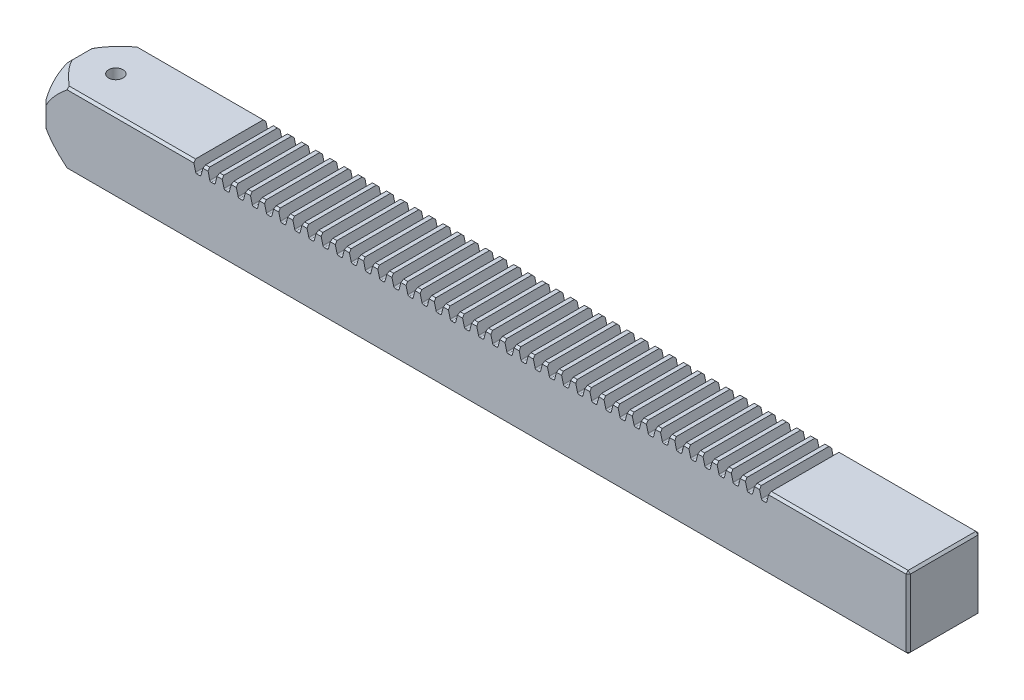
from build123d import *

# Parameters (mm, degrees)
SKETCH2_W                          = 25.4
SKETCH2_H                          = 25.4
BOSS_EXTRUDE1_DEPTH                = 304.8
CHAMFER1_SIZE                      = 0.762
CUT_EXTRUDE1_DEPTH                 = 307.120058147
LPATTERN1_COUNT                    = 41
LPATTERN1_PITCH                    = 4.98729
F_9_16_0_5625_DIAMETER_HOLE1_D     = 14.2875
F_9_16_0_5625_DIAMETER_HOLE1_DEPTH = 25.4
F_9_16_0_5625_DIAMETER_HOLE1_TIP   = 4.292398047
F_1_4_20_TAPPED_HOLE1_REACH        = 308.12
F_1_4_20_TAPPED_HOLE1_BORE_R       = 2.5527


with BuildPart() as part:
    # Sketch2 → Boss-Extrude1 (new body)
    with BuildSketch(Plane(origin=(0, 0, 0), x_dir=(0, 0, -1), z_dir=(1, 0, 0))):
        Rectangle(SKETCH2_W, SKETCH2_H)
    extrude(amount=BOSS_EXTRUDE1_DEPTH)

    # Chamfer1
    chamfer1_edges = [part.edges().sort_by_distance(p)[0] for p in [
        (304.8, 0, -12.7),
        (304.8, 12.7, 0),
        (304.8, 0, 12.7),
        (0, 12.7, 0),
        (0, 0, -12.7),
        (0, -12.7, 0),
        (0, 0, 12.7),
        (152.4, 12.7, 12.7),
        (152.4, 12.7, -12.7),
        (152.4, -12.7, -12.7),
        (152.4, -12.7, 12.7),
        (304.8, -12.7, 0),
    ]]
    chamfer(chamfer1_edges, length=CHAMFER1_SIZE)

    # Sketch3 → Cut-Extrude1 (cut, through all)
    with BuildSketch(Plane.XY.offset(12.7)):
        with BuildLine():
            Line((252.213834513, 12.7), (253.045505487, 9.484166958))
            ThreePointArc((253.045505487, 9.484166958), (253.22631811, 9.209689697), (253.537324488, 9.10336))
            Line((253.537324488, 9.10336), (254.462675512, 9.10336))
            ThreePointArc((254.462675512, 9.10336), (254.77368189, 9.209689697), (254.954494513, 9.484166958))
            Line((254.954494513, 9.484166958), (255.786165487, 12.7))
            Line((255.786165487, 12.7), (252.213834513, 12.7))
        make_face()
    cut_extrude1 = extrude(amount=-CUT_EXTRUDE1_DEPTH, mode=Mode.SUBTRACT)

    # LPattern1: Cut-Extrude1 ×41
    with Locations(*[(-i * LPATTERN1_PITCH, 0, 0) for i in range(1, LPATTERN1_COUNT)]):
        add(cut_extrude1, mode=Mode.SUBTRACT)

    # 9/16 (0.5625) Diameter Hole1
    with Locations(Plane.ZY):
        with Locations((0, 0)):
            Hole(F_9_16_0_5625_DIAMETER_HOLE1_D / 2, depth=F_9_16_0_5625_DIAMETER_HOLE1_DEPTH)
            with Locations((0, 0, -(F_9_16_0_5625_DIAMETER_HOLE1_DEPTH + F_9_16_0_5625_DIAMETER_HOLE1_TIP / 2))):  # 118° drill point
                Cone(0, F_9_16_0_5625_DIAMETER_HOLE1_D / 2, F_9_16_0_5625_DIAMETER_HOLE1_TIP, mode=Mode.SUBTRACT)

    # 1/4-20 Tapped Hole1 bore → 1/4-20 Tapped Hole1 (cut, up to next)
    with BuildSketch(Plane(origin=(0, 12.7, 0), x_dir=(1, 0, 0), z_dir=(0, 1, 0)), mode=Mode.PRIVATE) as f_1_4_20_tapped_hole1_sk1:
        with Locations((12.7, 0)):
            Circle(F_1_4_20_TAPPED_HOLE1_BORE_R)
    f_1_4_20_tapped_hole1_tool1 = extrude(f_1_4_20_tapped_hole1_sk1.sketch, amount=-F_1_4_20_TAPPED_HOLE1_REACH, mode=Mode.PRIVATE) & part.part
    add(f_1_4_20_tapped_hole1_tool1.solids().sort_by_distance((12.7, 12.7, 0))[0], mode=Mode.SUBTRACT)

    # Sketch8 → Cut-Revolve1 (revolve, cut)
    with BuildSketch(Plane.XY, mode=Mode.PRIVATE) as cut_revolve1_sk:
        Polygon((0, 12.7), (0, 17.78), (8.798818102, 17.78), align=None)
    revolve(cut_revolve1_sk.sketch.rotate(Axis((0, 0, 0), (1, 0, 0)), 90), axis=Axis((0, 0, 0), (1, 0, 0)), mode=Mode.SUBTRACT)


solid = part.part
